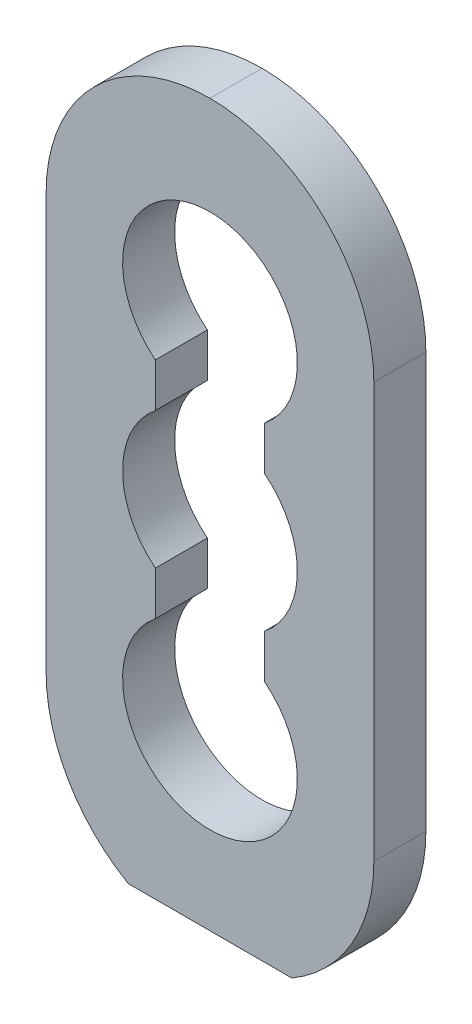
from build123d import *

# Parameters (mm, degrees)
CROQUIS1_W              = 30
CROQUIS1_H              = 68
SALIENTE_EXTRUIR1_DEPTH = 4.7625
REDONDEO1_R             = 15
CROQUIS2_R              = 8
CORTAR_EXTRUIR1_DEPTH   = 10
CROQUIS3_W              = 31.404872341
CROQUIS3_H              = 7.197905048
CORTAR_EXTRUIR2_DEPTH   = 10


with BuildPart() as part:
    # Croquis1 → Saliente-Extruir1 (new body)
    with BuildSketch(Plane.XY):
        Rectangle(CROQUIS1_W, CROQUIS1_H)
        with BuildLine():
            Line((5, 14), (5, -14))
            ThreePointArc((5, -14), (0, -19), (-5, -14))
            Line((-5, -14), (-5, 14))
            ThreePointArc((-5, 14), (0, 19), (5, 14))
        make_face(mode=Mode.SUBTRACT)
    extrude(amount=SALIENTE_EXTRUIR1_DEPTH)

    # Redondeo1
    redondeo1_edges = [part.edges().sort_by_distance(p)[0] for p in [
        (15, -34, 2.38125),
        (-15, -34, 2.38125),
        (-15, 34, 2.38125),
        (15, 34, 2.38125),
    ]]
    fillet(redondeo1_edges, radius=REDONDEO1_R - 0.0001)  # a hair under: the kernel refuses the full size

    # Croquis2 → Cortar-Extruir1 (cut)
    with BuildSketch(Plane.XY.offset(4.7625)):
        with Locations((0, 17)):
            Circle(CROQUIS2_R)
        with Locations((0, 0.5)):
            Circle(CROQUIS2_R)
        with Locations((0, -16)):
            Circle(CROQUIS2_R)
    extrude(amount=-CORTAR_EXTRUIR1_DEPTH, mode=Mode.SUBTRACT)

    # Croquis3 → Cortar-Extruir2 (cut)
    with BuildSketch(Plane.XY.offset(4.7625)):
        with Locations((0.058431815, -35.598952524)):
            Rectangle(CROQUIS3_W, CROQUIS3_H)
    extrude(amount=-CORTAR_EXTRUIR2_DEPTH, mode=Mode.SUBTRACT)


solid = part.part
